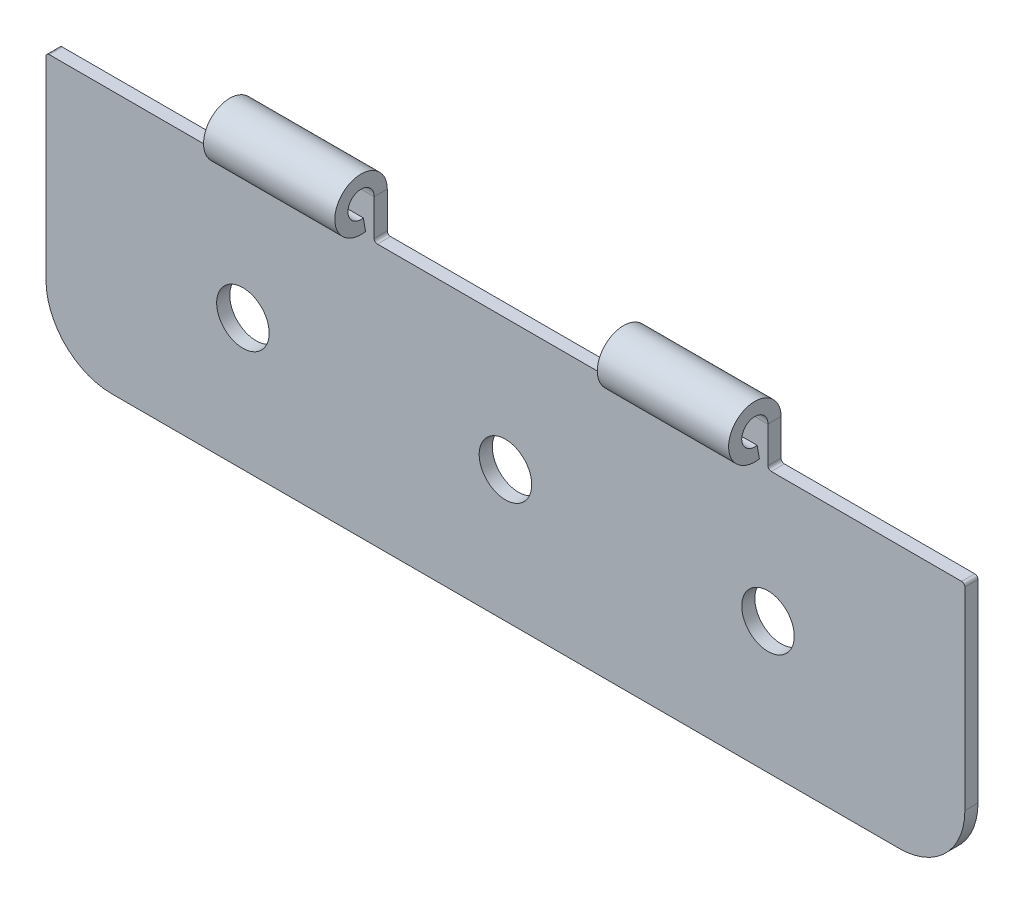
from build123d import *

# Parameters (mm, degrees)
SM_BASE_FLANGE_1_DEPTH = 1
OTHER_START            = 15
OTHER_1_DEPTH          = 40
OTHER_1_2_DEPTH        = 10
OTHER_START_2          = 45
OTHER_1_3_DEPTH        = 10
HOLE_WIZARD_M12_1_D    = 4
FILLET_1_R             = 5
FILLET_2_R             = 0.25


# Read off the part's stored shape, not the designer's step: 햄1
# Sheet-metal steps are written as plain solids
with BuildPart() as part:
    # Sketch 1 → 베이스-플랜지1 (new body)
    with BuildSketch(Plane.XY):
        Polygon((0, 0), (0, 20), (15, 20), (15, 25), (25, 25), (25, 20), (45, 20), (45, 25), (55, 25), (55, 20), (70, 20), (70, 0), align=None)
    extrude(amount=-SM_BASE_FLANGE_1_DEPTH)

    # Other 1 outline → Other 1 (cut)
    with BuildSketch(Plane.YZ.offset(OTHER_START)):
        with BuildLine():
            Line((25, 0), (24.732050807, 0))
            ThreePointArc((24.732050807, 0), (24, -0.732050808), (23, -1))
            Line((23, -1), (25, -1))
            Line((25, -1), (25, 0))
        make_face()
    extrude(amount=OTHER_1_DEPTH, mode=Mode.SUBTRACT)

    # Other 1 2 outline → Other 1 2 (add)
    with BuildSketch(Plane.YZ.offset(OTHER_START)):
        with BuildLine():
            Line((21.030384494, 0.652703645), (22.015192247, 0.826351822))
            ThreePointArc((22.015192247, 0.826351822), (23.64278761, 1.766044443), (23, 0))
            Line((23, 0), (24.732050807, 0))
            ThreePointArc((24.732050807, 0), (23.347296355, 2.969615506), (21.030384494, 0.652703645))
        make_face()
    extrude(amount=OTHER_1_2_DEPTH)

    # Other 1 3 outline → Other 1 3 (add)
    with BuildSketch(Plane.YZ.offset(OTHER_START_2)):
        with BuildLine():
            Line((21.030384494, 0.652703645), (22.015192247, 0.826351822))
            ThreePointArc((22.015192247, 0.826351822), (23.64278761, 1.766044443), (23, 0))
            Line((23, 0), (24.732050807, 0))
            ThreePointArc((24.732050807, 0), (23.347296355, 2.969615506), (21.030384494, 0.652703645))
        make_face()
    extrude(amount=OTHER_1_3_DEPTH)

    # M12 여유 구멍1 (through all)
    with Locations(Plane(origin=(15, 10, 0), x_dir=(1, 0, 0), z_dir=(0, 0, 1))):
        with Locations((0, 0), (20, 0), (40, 0)):
            Hole(HOLE_WIZARD_M12_1_D / 2)

    # 필렛1
    fillet_1_edges = [part.edges().sort_by_distance(p)[0] for p in [
        (0, 0, -0.5),
        (70, 0, -0.5),
    ]]
    fillet(fillet_1_edges, radius=FILLET_1_R)

    # 필렛2
    fillet_2_edges = [part.edges().sort_by_distance(p)[0] for p in [
        (0, 20, -0.5),
        (15, 20, -0.5),
        (25, 20, -0.5),
        (45, 20, -0.5),
        (55, 20, -0.5),
        (70, 20, -0.5),
    ]]
    fillet(fillet_2_edges, radius=FILLET_2_R)


solid = part.part
